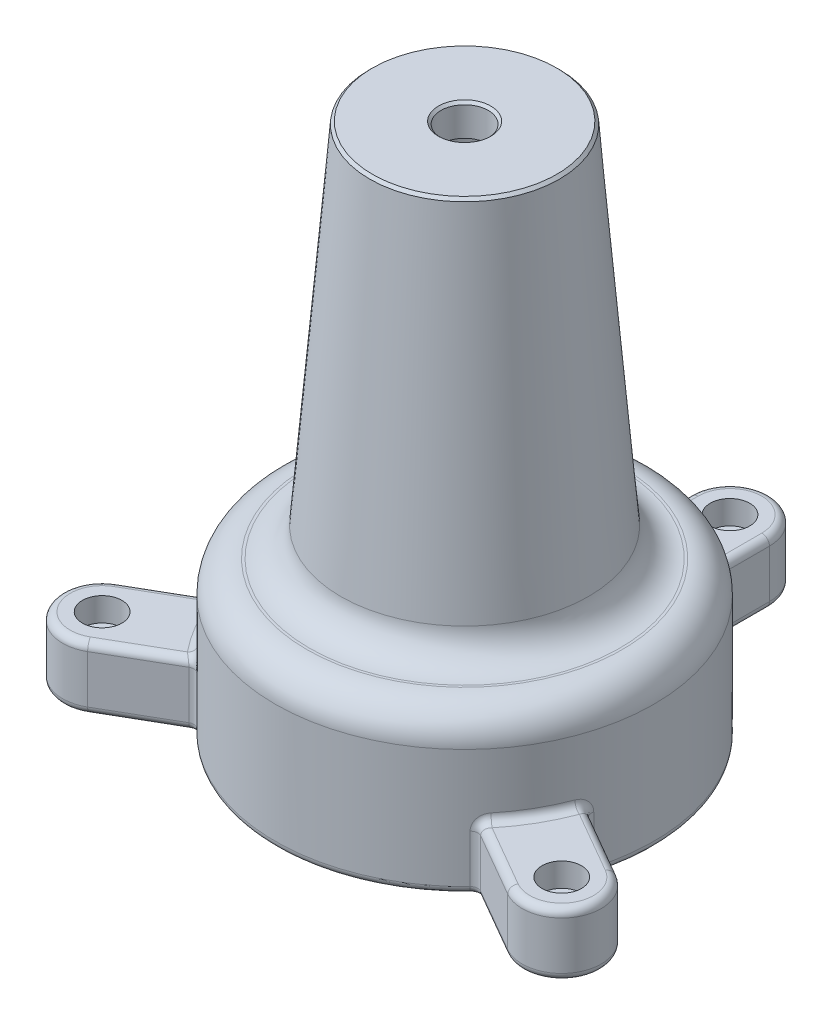
from build123d import *
from OCP.BRepFilletAPI import BRepFilletAPI_MakeChamfer

# Parameters (mm, degrees)
SKETCH1_R                                       = 38.1
BOSS_EXTRUDE1_DEPTH                             = 31.75
BOSS_EXTRUDE2_DEPTH                             = 12.7
SKETCH4_R                                       = 4.7625
CUT_EXTRUDE1_DEPTH                              = 136.466897566
CHAMFER1_SIZE                                   = 0.508
CHAMFER1_SIZE2                                  = 0.556102731
FILLET1_R                                       = 6.35
FILLET2_R                                       = 1.524
CBORE_FOR_6_PAN_HEAD_MACHINE_SCREW1_D           = 4.7752
CBORE_FOR_6_PAN_HEAD_MACHINE_SCREW1_CBORE_D     = 7.9502
CBORE_FOR_6_PAN_HEAD_MACHINE_SCREW1_CBORE_DEPTH = 4.7752


# Read off the part's stored shape, not the designer's step: Shell1
with BuildPart() as part:
    # Sketch1 → Boss-Extrude1 (new body)
    with BuildSketch(Plane(origin=(0, 0, 0), x_dir=(1, 0, 0), z_dir=(0, 1, 0))):
        with Locations(Location((0, 0, 0), (0, 0, 270))):
            Circle(SKETCH1_R)
    extrude(amount=BOSS_EXTRUDE1_DEPTH)

    # Sketch2 → Boss-Extrude2 (add)
    with BuildSketch(Plane(origin=(0, 0, 0), x_dir=(1, 0, 0), z_dir=(0, 1, 0))):
        with BuildLine():
            Line((-7.9502, 53.386280494), (-7.9502, 37.261297883))
            ThreePointArc((-7.9502, 37.261297883), (0, 38.1), (7.9502, 37.261297883))
            Line((7.9502, 37.261297883), (7.9502, 53.386280494))
            ThreePointArc((7.9502, 53.386280494), (0, 61.336480494), (-7.9502, 53.386280494))
        make_face()
        with BuildLine():
            Line((-36.244330545, -11.745573777), (-50.208975121, -19.808065082))
            ThreePointArc((-50.208975121, -19.808065082), (-53.118950286, -30.668240247), (-42.258775121, -33.578215412))
            Line((-42.258775121, -33.578215412), (-28.294130545, -25.515724107))
            ThreePointArc((-28.294130545, -25.515724107), (-32.995567884, -19.05), (-36.244330545, -11.745573777))
        make_face()
        with BuildLine():
            Line((28.294130545, -25.515724107), (42.258775121, -33.578215412))
            ThreePointArc((42.258775121, -33.578215412), (53.118950286, -30.668240247), (50.208975121, -19.808065082))
            Line((50.208975121, -19.808065082), (36.244330545, -11.745573777))
            ThreePointArc((36.244330545, -11.745573777), (32.995567884, -19.05), (28.294130545, -25.515724107))
        make_face()
    extrude(amount=BOSS_EXTRUDE2_DEPTH)

    # Sketch3 → Revolve1 (revolve)
    with BuildSketch(Plane.XY, mode=Mode.PRIVATE) as revolve1_sk:
        Polygon((0, 107.95), (19.05, 107.95), (25.4, 31.75), (0, 31.75), align=None)
    revolve(revolve1_sk.sketch.rotate(Axis((0, 0, 0), (0, 1, 0)), 77.955773052), axis=Axis((0, 0, 0), (0, 1, 0)))

    # Shell1 outline → Shell1 (revolve, cut)
    with BuildSketch(Plane.XY):
        Polygon((31.75, 6.35), (31.75, 25.4), (19.557156202, 25.4), (13.207156202, 101.6), (0, 101.6), (0, 6.35), align=None)
    revolve(axis=Axis((0, 0, 0), (0, 1, 0)), mode=Mode.SUBTRACT)

    # Sketch4 → Cut-Extrude1 (cut, through all)
    with BuildSketch(Plane(origin=(0, 107.95, 0), x_dir=(1, 0, 0), z_dir=(0, 1, 0))):
        with Locations(Location((0, 0, 0), (0, 0, 180))):
            Circle(SKETCH4_R)
    extrude(amount=-CUT_EXTRUDE1_DEPTH, mode=Mode.SUBTRACT)

    # Chamfer1: one chamfer whose edges measure the first distance from different faces: ONE call of the kernel's chamfer builder (chamfer() names one face for all edges)
    chamfer1_edges_1 = [part.edges().sort_by_distance(p)[0] for p in [
        (-3.9751, 107.95, 18.630648942),
    ]]
    chamfer1_side_1 = [part.faces().sort_by_distance(p)[0] for p in [
        (-3.862667193, 107.95, 18.103694614),
    ]]
    chamfer1_edges_2 = [part.edges().sort_by_distance(p)[0] for p in [
        (4.7625, 107.95, 0),
    ]]
    chamfer1 = BRepFilletAPI_MakeChamfer(part.part.solid().wrapped)
    for e in chamfer1_edges_1:
        chamfer1.Add(CHAMFER1_SIZE, CHAMFER1_SIZE2, e.wrapped, chamfer1_side_1[0].wrapped)  # the first distance lies on this face
    for e in chamfer1_edges_2:
        chamfer1.Add(CHAMFER1_SIZE, e.wrapped)
    add(Compound.cast(chamfer1.Shape()), mode=Mode.REPLACE)

    # Fillet1
    fillet1_edges = [part.edges().sort_by_distance(p)[0] for p in [
        (-5.300133333, 31.75, 24.840865256),
        (0, 31.75, -38.1),
    ]]
    fillet(fillet1_edges, radius=FILLET1_R)

    # Fillet2
    fillet2_edges = [part.edges().sort_by_distance(p)[0] for p in [
        (0, 12.7, -38.1),
        (7.9502, 12.7, -45.323789189),
        (0, 0, -61.336480494),
        (-7.9502, 0, -45.323789189),
        (32.995567884, 0, -19.05),
        (43.226652833, 12.7, 15.776819429),
        (36.244330545, 6.35, 11.745573777),
        (35.276452833, 0, 29.546969759),
        (28.294130545, 6.35, 25.515724107),
        (53.118950286, 12.7, 30.668240247),
        (32.995567884, 12.7, 19.05),
        (35.276452833, 12.7, 29.546969759),
        (43.226652833, 0, 15.776819429),
        (53.118950286, 0, 30.668240247),
        (15.483231438, 0, 34.812060327),
        (-28.294130545, 6.35, 25.515724107),
        (-43.226652833, 0, 15.776819429),
        (-36.244330545, 6.35, 11.745573777),
        (-53.118950286, 12.7, 30.668240247),
        (-35.276452833, 12.7, 29.546969759),
        (-35.276452833, 0, 29.546969759),
        (-53.118950286, 0, 30.668240247),
        (-32.995567884, 12.7, 19.05),
        (-43.226652833, 12.7, 15.776819429),
        (-32.995567884, 0, -19.05),
        (0, 12.7, -61.336480494),
        (-7.9502, 12.7, -45.323789189),
        (-7.9502, 6.35, -37.261297883),
        (7.9502, 0, -45.323789189),
        (7.9502, 6.35, -37.261297883),
    ]]
    fillet(fillet2_edges, radius=FILLET2_R)

    # CBORE for #6 Pan Head Machine Screw1 (through all)
    with Locations(Plane(origin=(-46.233875121, 12.7, 26.693140247), x_dir=(0, 0, 1), z_dir=(0, 1, 0))):
        with Locations((0, 0), (0, 92.467750242), (-80.079420741, 46.233875121)):
            CounterBoreHole(CBORE_FOR_6_PAN_HEAD_MACHINE_SCREW1_D / 2, CBORE_FOR_6_PAN_HEAD_MACHINE_SCREW1_CBORE_D / 2, CBORE_FOR_6_PAN_HEAD_MACHINE_SCREW1_CBORE_DEPTH)


solid = part.part
